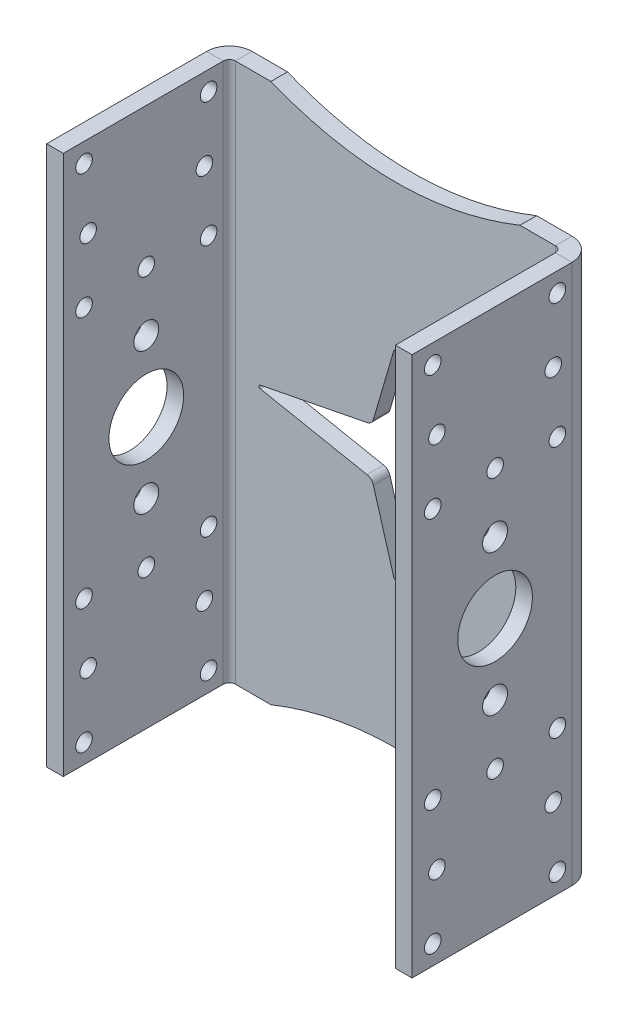
from build123d import *

# Parameters (mm, degrees)
SKETCH_1_W                       = 44
SKETCH_1_H                       = 65
SM_BASE_FLANGE_1_DEPTH           = 2
SM_EDGE_FLANGE_1_STRIP_W         = 9.4732
SM_EDGE_FLANGE_1_STRIP_H         = 2
SM_EDGE_FLANGE_1_STRIP_CUT_DEPTH = 65
SM_EDGE_FLANGE_1_DEPTH           = 65
SM_EDGE_FLANGE_2_STRIP_W         = 9.4732
SM_EDGE_FLANGE_2_STRIP_H         = 2
SM_EDGE_FLANGE_2_STRIP_CUT_DEPTH = 65
SM_EDGE_FLANGE_2_DEPTH           = 65
CUT_EXTRUDE_1_DEPTH              = 2
CUT_EXTRUDE_2_DEPTH              = 2
CUT_EXTRUDE_3_DEPTH              = 2
SKETCH_16_R                      = 1
SKETCH_16_R_2                    = 4.5
SKETCH_16_R_3                    = 1.5
CUT_EXTRUDE_5_DEPTH              = 50
FILLET_2_R                       = 0.2
FILLET_3_R                       = 0.2
FILLET_4_R                       = 0.2
FILLET_5_R                       = 0.2
FILLET_7_R                       = 1


# Sheet-metal steps are written as plain solids
with BuildPart() as part:
    # Sketch 1 → 基体-法兰1 (new body)
    with BuildSketch(Plane.XY):
        with Locations((-2.910505837, -3.223735409)):
            Rectangle(SKETCH_1_W, SKETCH_1_H)
    extrude(amount=-SM_BASE_FLANGE_1_DEPTH)

    # 边线-法兰1 strip (across the edge) → 边线-法兰1 strip cut (cut)
    with BuildSketch(Plane(origin=(-24.910505837, 29.276264591, 0), x_dir=(1, 0, 0), z_dir=(0, -1, 0))):
        with Locations((-2, -1)):
            Rectangle(SM_EDGE_FLANGE_1_STRIP_W, SM_EDGE_FLANGE_1_STRIP_H)
    extrude(amount=SM_EDGE_FLANGE_1_STRIP_CUT_DEPTH, mode=Mode.SUBTRACT)

    # 边线-法兰1 section (across the edge) → 边线-法兰1 (add)
    with BuildSketch(Plane(origin=(-24.910505837, 29.276264591, 0), x_dir=(1, 0, 0), z_dir=(0, -1, 0))):
        with BuildLine():
            Line((0, 0.7366), (0, 20))
            Line((0, 20), (2, 20))
            Line((2, 20), (2, 0.7366))
            ThreePointArc((2, 0.7366), (2.215745145, 0.215745145), (2.7366, 0))
            Line((2.7366, 0), (2.7366, -2))
            ThreePointArc((2.7366, -2), (0.801531583, -1.198468417), (0, 0.7366))
        make_face()
    extrude(amount=SM_EDGE_FLANGE_1_DEPTH)

    # 边线-法兰2 strip (across the edge) → 边线-法兰2 strip cut (cut)
    with BuildSketch(Plane(origin=(19.089494163, -35.723735409, 0), x_dir=(-1, 0, 0), z_dir=(0, 1, 0))):
        with Locations((-2, -1)):
            Rectangle(SM_EDGE_FLANGE_2_STRIP_W, SM_EDGE_FLANGE_2_STRIP_H)
    extrude(amount=SM_EDGE_FLANGE_2_STRIP_CUT_DEPTH, mode=Mode.SUBTRACT)

    # 边线-法兰2 section (across the edge) → 边线-法兰2 (add)
    with BuildSketch(Plane(origin=(19.089494163, -35.723735409, 0), x_dir=(-1, 0, 0), z_dir=(0, 1, 0))):
        with BuildLine():
            Line((0, 0.7366), (0, 20))
            Line((0, 20), (2, 20))
            Line((2, 20), (2, 0.7366))
            ThreePointArc((2, 0.7366), (2.215745145, 0.215745145), (2.7366, 0))
            Line((2.7366, 0), (2.7366, -2))
            ThreePointArc((2.7366, -2), (0.801531583, -1.198468417), (0, 0.7366))
        make_face()
    extrude(amount=SM_EDGE_FLANGE_2_DEPTH)

    # 草图12 → 切除-拉伸1 (cut)
    with BuildSketch(Plane(origin=(0, 0, -2), x_dir=(-1, 0, 0), z_dir=(0, 0, -1))):
        Polygon((-14.352894163, -3.223735409), (0.082078712, -0.395308284), (2.910505837, 9.276264591), (5.738932961, -0.395308284), (20.173905837, -3.223735409), (5.738932961, -6.052162533), (2.910505837, -15.723735409), (0.082078712, -6.052162533), align=None)
    extrude(amount=-CUT_EXTRUDE_1_DEPTH, mode=Mode.SUBTRACT)

    # 草图13 → 切除-拉伸2 (cut)
    with BuildSketch(Plane(origin=(0, 0, -2), x_dir=(-1, 0, 0), z_dir=(0, 0, -1))):
        with BuildLine():
            Line((2.910505837, 29.276264591), (17.910505837, 29.276264591))
            add(Edge.make_bspline(
                [(-12.089494163, 29.276264591), (2.910505837, 23.276264591), (17.910505837, 29.276264591)],
                knots=[0, 0, 0, 1, 1, 1], degree=2))
            Line((-12.089494163, 29.276264591), (2.910505837, 29.276264591))
        make_face()
    extrude(amount=-CUT_EXTRUDE_2_DEPTH, mode=Mode.SUBTRACT)

    # 草图14 → 切除-拉伸3 (cut)
    with BuildSketch(Plane(origin=(0, 0, -2), x_dir=(-1, 0, 0), z_dir=(0, 0, -1))):
        with BuildLine():
            Line((2.910505837, -35.723735409), (17.910505837, -35.723735409))
            add(Edge.make_bspline(
                [(-12.089494163, -35.723735409), (2.910505837, -29.723735409), (17.910505837, -35.723735409)],
                knots=[0, 0, 0, 1, 1, 1], degree=2))
            Line((-12.089494163, -35.723735409), (2.910505837, -35.723735409))
        make_face()
    extrude(amount=-CUT_EXTRUDE_3_DEPTH, mode=Mode.SUBTRACT)

    # 草图16 → 切除-拉伸5 (cut)
    with BuildSketch(Plane(origin=(19.089494163, 0, 0), x_dir=(0, 0, -1), z_dir=(1, 0, 0))):
        with Locations((-17.5, 26.95590493)):
            Circle(SKETCH_16_R)
        with Locations((-2.5, 26.95590493)):
            Circle(SKETCH_16_R)
        with Locations((-2.5, 11.95590493)):
            Circle(SKETCH_16_R)
        with Locations((-17.5, 11.95590493)):
            Circle(SKETCH_16_R)
        with Locations((-3, 19.45590493)):
            Circle(SKETCH_16_R)
        with Locations(Location((-17, 19.45590493, 0), (0, 0, 180))):
            Circle(SKETCH_16_R)
        with Locations((-10, 12.45590493)):
            Circle(SKETCH_16_R)
        with Locations(Location((-10, -18.903375747, 0), (0, 0, 180))):
            Circle(SKETCH_16_R)
        with Locations((-17, -25.903375747)):
            Circle(SKETCH_16_R)
        with Locations(Location((-3, -25.903375747, 0), (0, 0, 180))):
            Circle(SKETCH_16_R)
        with Locations(Location((-17.5, -18.403375747, 0), (0, 0, 180))):
            Circle(SKETCH_16_R)
        with Locations(Location((-2.5, -18.403375747, 0), (0, 0, 180))):
            Circle(SKETCH_16_R)
        with Locations(Location((-2.5, -33.403375747, 0), (0, 0, 180))):
            Circle(SKETCH_16_R)
        with Locations(Location((-17.5, -33.403375747, 0), (0, 0, 180))):
            Circle(SKETCH_16_R)
        with Locations((-10, -3.223735409)):
            Circle(SKETCH_16_R_2)
        with Locations((-10, 5.276264591)):
            Circle(SKETCH_16_R_3)
        with Locations(Location((-10, -11.723735409, 0), (0, 0, 180))):
            Circle(SKETCH_16_R_3)
    extrude(amount=-CUT_EXTRUDE_5_DEPTH, mode=Mode.SUBTRACT)

    # 圆角2
    fillet_2_edges = [part.edges().sort_by_distance(p)[0] for p in [
        (-2.910505837, 9.276264591, -1),
    ]]
    fillet(fillet_2_edges, radius=FILLET_2_R)

    # 圆角3
    fillet_3_edges = [part.edges().sort_by_distance(p)[0] for p in [
        (-20.173905837, -3.223735409, -1),
    ]]
    fillet(fillet_3_edges, radius=FILLET_3_R)

    # 圆角4
    fillet_4_edges = [part.edges().sort_by_distance(p)[0] for p in [
        (-2.910505837, -15.723735409, -1),
    ]]
    fillet(fillet_4_edges, radius=FILLET_4_R)

    # 圆角5
    fillet_5_edges = [part.edges().sort_by_distance(p)[0] for p in [
        (14.352894163, -3.223735409, -1),
    ]]
    fillet(fillet_5_edges, radius=FILLET_5_R)

    # 圆角7
    fillet_7_edges = [part.edges().sort_by_distance(p)[0] for p in [
        (-0.082078712, -0.395308284, -1),
        (-5.738932961, -0.395308284, -1),
        (-5.738932961, -6.052162533, -1),
        (-0.082078712, -6.052162533, -1),
    ]]
    fillet(fillet_7_edges, radius=FILLET_7_R)


solid = part.part
